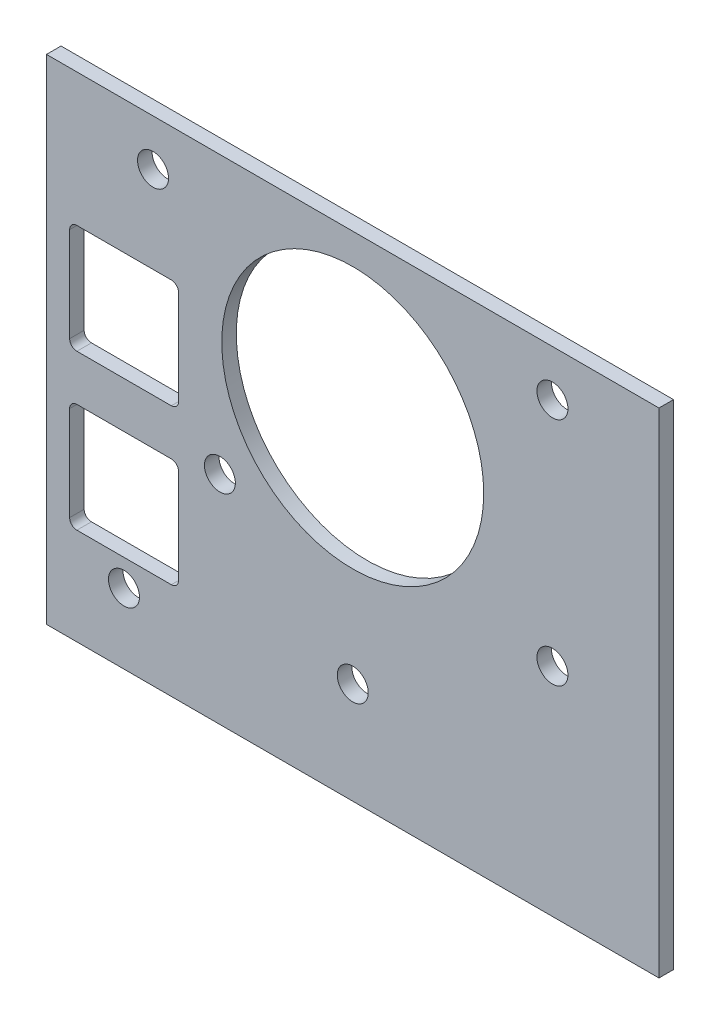
from build123d import *

# Parameters (mm, degrees)
SKETCH1_W           = 42.164
SKETCH1_H           = 33.9852
SKETCH1_R           = 9.017
SKETCH1_R_2         = 1.0668
SKETCH1_R_3         = 1.063335115
BOSS_EXTRUDE1_DEPTH = 1


with BuildPart() as part:
    # Sketch1 → Boss-Extrude1 (new body)
    with BuildSketch(Plane(origin=(0, 0, -1.017418828), x_dir=(-1, 0, 0), z_dir=(0, 0, -1))):
        with Locations((105.86640625, -145.76953125)):
            Rectangle(SKETCH1_W, SKETCH1_H)
        with Locations((105.86640625, -139.89895625)):
            Circle(SKETCH1_R, mode=Mode.SUBTRACT)
        with Locations((92.118252965, -147.83645625)):
            Circle(SKETCH1_R_2, mode=Mode.SUBTRACT)
        with Locations((92.118252965, -131.96145625)):
            Circle(SKETCH1_R_2, mode=Mode.SUBTRACT)
        with Locations((119.614559536, -131.96145625)):
            Circle(SKETCH1_R_2, mode=Mode.SUBTRACT)
        with Locations((105.86640625, -155.77395625)):
            Circle(SKETCH1_R_2, mode=Mode.SUBTRACT)
        with Locations((115.01040625, -147.83645625)):
            Circle(SKETCH1_R_3, mode=Mode.SUBTRACT)
        with Locations((121.614405679, -157.93295625)):
            Circle(SKETCH1_R_2, mode=Mode.SUBTRACT)
        with BuildLine():
            Line((118.356545978, -137.93013125), (124.856545978, -137.93013125))
            ThreePointArc((124.856545978, -137.93013125), (125.210099369, -138.07657786), (125.356545978, -138.43013125))
            Line((125.356545978, -138.43013125), (125.356545978, -144.93013125))
            ThreePointArc((125.356545978, -144.93013125), (125.210099369, -145.283684641), (124.856545978, -145.43013125))
            Line((124.856545978, -145.43013125), (118.356545978, -145.43013125))
            ThreePointArc((118.356545978, -145.43013125), (118.002992588, -145.283684641), (117.856545978, -144.93013125))
            Line((117.856545978, -144.93013125), (117.856545978, -138.43013125))
            ThreePointArc((117.856545978, -138.43013125), (118.002992588, -138.07657786), (118.356545978, -137.93013125))
        make_face(mode=Mode.SUBTRACT)
        with BuildLine():
            Line((124.856545978, -156.09813125), (118.356545978, -156.09813125))
            ThreePointArc((118.356545978, -156.09813125), (118.002992588, -155.951684641), (117.856545978, -155.59813125))
            Line((117.856545978, -155.59813125), (117.856545978, -149.09813125))
            ThreePointArc((117.856545978, -149.09813125), (118.002992588, -148.74457786), (118.356545978, -148.59813125))
            Line((118.356545978, -148.59813125), (124.856545978, -148.59813125))
            ThreePointArc((124.856545978, -148.59813125), (125.210099369, -148.74457786), (125.356545978, -149.09813125))
            Line((125.356545978, -149.09813125), (125.356545978, -155.59813125))
            ThreePointArc((125.356545978, -155.59813125), (125.210099369, -155.951684641), (124.856545978, -156.09813125))
        make_face(mode=Mode.SUBTRACT)
    extrude(amount=-BOSS_EXTRUDE1_DEPTH)


solid = part.part
